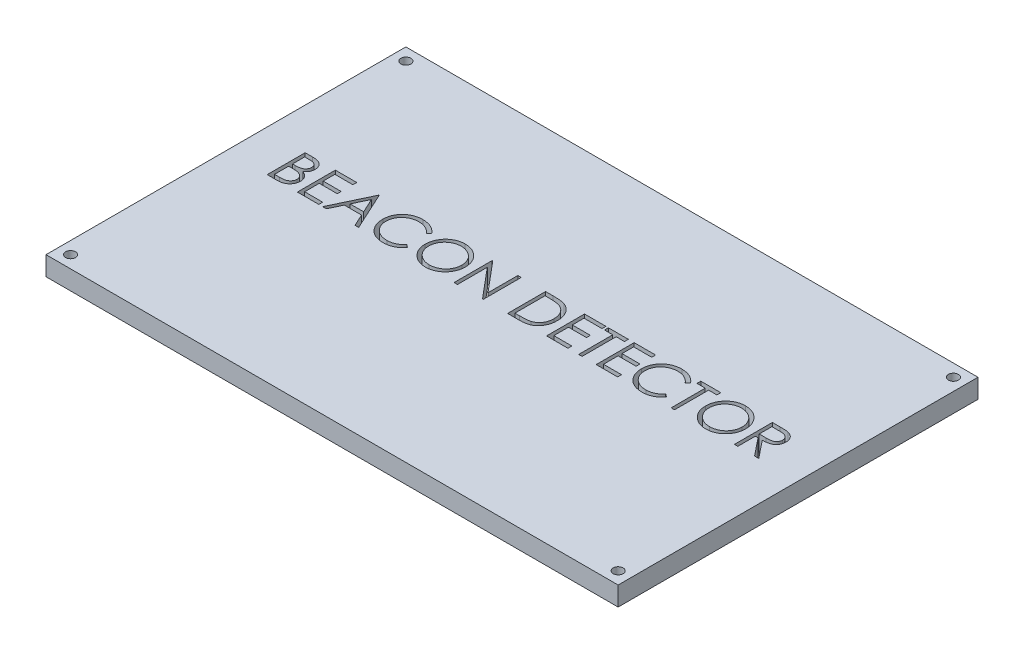
from build123d import *

# Parameters (mm, degrees)
SKETCH1_W           = 159.512
SKETCH1_H           = 100.33
BOSS_EXTRUDE1_DEPTH = 5.334
SKETCH2_R           = 1.397
CUT_EXTRUDE1_DEPTH  = 147.710432419
CUT_EXTRUDE2_DEPTH  = 147.710432419


with BuildPart() as part:
    # Sketch1 → Boss-Extrude1 (new body)
    with BuildSketch(Plane(origin=(0, 0, 0), x_dir=(1, 0, 0), z_dir=(0, 1, 0))):
        with Locations((-54.024132715, 9.8214611)):
            Rectangle(SKETCH1_W, SKETCH1_H)
    extrude(amount=BOSS_EXTRUDE1_DEPTH)

    # Sketch2 → Cut-Extrude1 (cut, through all)
    with BuildSketch(Plane(origin=(0, 5.334, 0), x_dir=(1, 0, 0), z_dir=(0, 1, 0))):
        with Locations((-130.351132715, 56.5574611)):
            Circle(SKETCH2_R)
        with Locations((22.302867285, 56.5574611)):
            Circle(SKETCH2_R)
        with Locations((22.302867285, -36.9145389)):
            Circle(SKETCH2_R)
        with Locations((-130.351132715, -36.9145389)):
            Circle(SKETCH2_R)
    extrude(amount=-CUT_EXTRUDE1_DEPTH, mode=Mode.SUBTRACT)

    # Sketch3 → Cut-Extrude2 (cut, through all)
    # profile 1 of 14: a face of its own
    with BuildSketch(Plane(origin=(0, 5.334, 0), x_dir=(1, 0, 0), z_dir=(0, 1, 0))):
        with BuildLine():
            Line((-122.273064339, 20.404794434), (-120.208127106, 20.404794434))
            add(Edge.make_bspline(
                [(-120.208127106, 20.404794434), (-120.107045755, 20.404262998), (-119.911124941, 20.403232943), (-119.626223295, 20.387257761), (-119.359375701, 20.365475235), (-119.110504771, 20.330912812), (-118.879725504, 20.289209105), (-118.66634241, 20.238705995), (-118.471034032, 20.17814933), (-118.237859805, 20.081852241), (-117.972004474, 19.938755994), (-117.684142667, 19.727305333), (-117.437991753, 19.468671456), (-117.225761698, 19.176926284), (-117.057029742, 18.855991926), (-116.934960676, 18.513517713), (-116.857678529, 18.153921017), (-116.849730644, 17.907047598), (-116.845713912, 17.782281747)],
                knots=[0, 0, 0, 0, 1.001505555, 1.941167018, 2.826882275, 3.653841531, 4.429895133, 5.150066043, 5.825578002, 6.45369114, 7.647487171, 8.808567382, 9.977351308, 11.170798116, 12.373658725, 13.556498008, 14.765093433, 16, 16, 16, 16], degree=3))
            add(Edge.make_bspline(
                [(-116.845713912, 17.782281747), (-116.849019596, 17.665403781), (-116.855515577, 17.435727555), (-116.917632969, 17.09980013), (-117.014880704, 16.780028587), (-117.150060862, 16.477579945), (-117.325750232, 16.19928783), (-117.533964672, 15.942907287), (-117.785173098, 15.719293377), (-117.9733848, 15.594280314), (-118.068987817, 15.530779343)],
                knots=[0, 0, 0, 0, 1.044552857, 2.05264487, 3.044412934, 4.028983338, 5.005914585, 5.980388656, 6.974128949, 8, 8, 8, 8], degree=3))
            add(Edge.make_bspline(
                [(-118.068987817, 15.530779343), (-117.948759857, 15.484620894), (-117.718733987, 15.396308346), (-117.402183426, 15.240172538), (-117.129451395, 15.070349014), (-116.898440977, 14.884893181), (-116.700872354, 14.68499273), (-116.528355126, 14.467716551), (-116.381151923, 14.230230307), (-116.255019988, 13.975010093), (-116.156598749, 13.704661962), (-116.082890657, 13.421721758), (-116.040655752, 13.127204056), (-116.034645503, 12.926769694), (-116.031611348, 12.825584364)],
                knots=[0, 0, 0, 0, 1.27268992, 2.434971085, 3.483601985, 4.442670788, 5.356604649, 6.2567628, 7.179492994, 8.113709626, 9.066344395, 10.018646069, 10.999752585, 12, 12, 12, 12], degree=3))
            add(Edge.make_bspline(
                [(-116.031611348, 12.825584364), (-116.034565144, 12.722270251), (-116.040376821, 12.518996839), (-116.083254355, 12.220380122), (-116.155853321, 11.93500826), (-116.255854168, 11.661035445), (-116.386368786, 11.398991705), (-116.545203345, 11.148580169), (-116.734589264, 10.912316836), (-116.946446034, 10.687576357), (-117.186119664, 10.485501857), (-117.444703019, 10.305537696), (-117.725452605, 10.157534127), (-118.023757444, 10.03320711), (-118.342963828, 9.938237724), (-118.681638379, 9.871796846), (-119.039489006, 9.827029234), (-119.285051825, 9.823348638), (-119.410985012, 9.8214611)],
                knots=[0, 0, 0, 0, 0.978564426, 1.925352924, 2.850884081, 3.763762016, 4.682927383, 5.618979971, 6.567305752, 7.547517671, 8.540179244, 9.531824382, 10.526200242, 11.540722885, 12.589160233, 13.674978461, 14.80764778, 16, 16, 16, 16], degree=3))
            Line((-119.410985012, 9.8214611), (-122.273064339, 9.8214611))
            Line((-122.273064339, 9.8214611), (-122.273064339, 20.404794434))
        make_face()
        with BuildLine():
            Line((-121.323278014, 19.319324348), (-121.323278014, 15.927230331))
            Line((-121.323278014, 15.927230331), (-120.685140327, 15.927230331))
            add(Edge.make_bspline(
                [(-120.685140327, 15.927230331), (-120.591859446, 15.928439622), (-120.411621774, 15.930776219), (-120.150606849, 15.937469473), (-119.908324056, 15.956211175), (-119.685191608, 15.974947492), (-119.481560885, 16.005411126), (-119.297883018, 16.041673021), (-119.131275355, 16.08002371), (-118.939143873, 16.14524573), (-118.721209005, 16.241637748), (-118.488880332, 16.391231157), (-118.284064198, 16.569407178), (-118.111110797, 16.774998895), (-117.969561827, 17.001379981), (-117.871246545, 17.244938405), (-117.804579757, 17.499604043), (-117.798557746, 17.674435426), (-117.795500236, 17.763201218)],
                knots=[0, 0, 0, 0, 1.156816544, 2.235205308, 3.236616184, 4.169592532, 5.011045266, 5.787822928, 6.49130361, 7.128639758, 8.301311294, 9.436451833, 10.541879658, 11.654887649, 12.756523258, 13.837046038, 14.901820046, 16, 16, 16, 16], degree=3))
            add(Edge.make_bspline(
                [(-117.795500236, 17.763201218), (-117.797091305, 17.821941051), (-117.80021236, 17.937165647), (-117.825773537, 18.105136313), (-117.869218345, 18.26311147), (-117.925020613, 18.413256042), (-118.003000696, 18.550875208), (-118.094814025, 18.680727252), (-118.205744565, 18.798390086), (-118.332010724, 18.908364522), (-118.477179655, 19.005865832), (-118.641164752, 19.091260521), (-118.826184633, 19.160024298), (-119.029121123, 19.220246949), (-119.253097983, 19.262544885), (-119.495530561, 19.29778251), (-119.758404592, 19.315721992), (-119.940271926, 19.318096779), (-120.034282288, 19.319324348)],
                knots=[0, 0, 0, 0, 0.91205012, 1.789085906, 2.630437955, 3.453916878, 4.269457761, 5.079663411, 5.91843418, 6.774407191, 7.675494373, 8.627863946, 9.638891023, 10.736472738, 11.911756761, 13.175263542, 14.539845004, 16, 16, 16, 16], degree=3))
            Line((-120.034282288, 19.319324348), (-121.323278014, 19.319324348))
        make_face(mode=Mode.SUBTRACT)
        with BuildLine():
            Line((-121.323278014, 14.841760246), (-121.323278014, 10.906931186))
            Line((-121.323278014, 10.906931186), (-119.970680525, 10.906931186))
            add(Edge.make_bspline(
                [(-119.970680525, 10.906931186), (-119.873861392, 10.908091565), (-119.687255277, 10.910328042), (-119.417830128, 10.917629195), (-119.168114553, 10.934236791), (-118.939248047, 10.960380194), (-118.728759297, 10.988738838), (-118.539173386, 11.026872949), (-118.368953491, 11.070563853), (-118.171576418, 11.138098136), (-117.949315809, 11.243013655), (-117.709797268, 11.401201911), (-117.496841798, 11.589655723), (-117.316002086, 11.807765868), (-117.167796144, 12.044927262), (-117.05998084, 12.296342963), (-116.993484678, 12.557858724), (-116.985434785, 12.736162831), (-116.981397672, 12.825584364)],
                knots=[0, 0, 0, 0, 1.160039823, 2.235823828, 3.228722157, 4.157150951, 4.99529583, 5.772374946, 6.472645482, 7.099169577, 8.269452708, 9.405989375, 10.527446681, 11.663510218, 12.788923519, 13.866172445, 14.929861265, 16, 16, 16, 16], degree=3))
            add(Edge.make_bspline(
                [(-116.981397672, 12.825584364), (-116.982232559, 12.881504703), (-116.983888866, 12.992443382), (-117.008867392, 13.155474549), (-117.045195046, 13.313395642), (-117.092159144, 13.466635477), (-117.160556104, 13.612423543), (-117.240404466, 13.753643187), (-117.334025847, 13.89048109), (-117.479907016, 14.063480046), (-117.692093731, 14.262800538), (-117.993588028, 14.457949652), (-118.336404262, 14.615332307), (-118.585044538, 14.682156914), (-118.71348568, 14.716676779)],
                knots=[0, 0, 0, 0, 0.723448775, 1.435228256, 2.130040452, 2.821711965, 3.505591119, 4.210454504, 4.921174351, 5.648778258, 7.137944449, 8.670945889, 10.280296675, 12, 12, 12, 12], degree=3))
            add(Edge.make_bspline(
                [(-118.71348568, 14.716676779), (-118.764978422, 14.727124294), (-118.876625308, 14.749776664), (-119.058681564, 14.773688052), (-119.266525739, 14.794990972), (-119.500637772, 14.81074852), (-119.761313863, 14.827036402), (-120.049110736, 14.833370742), (-120.362853092, 14.840928028), (-120.580544314, 14.841475744), (-120.693620562, 14.841760246)],
                knots=[0, 0, 0, 0, 0.634451884, 1.375622551, 2.216452059, 3.157844607, 4.20941857, 5.370758133, 6.634282058, 8, 8, 8, 8], degree=3))
            Line((-120.693620562, 14.841760246), (-121.323278014, 14.841760246))
        make_face(mode=Mode.SUBTRACT)
    # profile 2 of 14: a face of its own
    with BuildSketch(Plane(origin=(0, 5.334, 0), x_dir=(1, 0, 0), z_dir=(0, 1, 0))):
        Polygon((-113.860671177, 20.404794434), (-107.890585707, 20.404794434), (-107.890585707, 19.319324348), (-112.910884852, 19.319324348), (-112.910884852, 16.062914092), (-107.890585707, 16.062914092), (-107.890585707, 14.977444006), (-112.910884852, 14.977444006), (-112.910884852, 10.906931186), (-107.890585707, 10.906931186), (-107.890585707, 9.8214611), (-113.860671177, 9.8214611), align=None)
    # profile 3 of 14: a face of its own
    with BuildSketch(Plane(origin=(0, 5.334, 0), x_dir=(1, 0, 0), z_dir=(0, 1, 0))):
        Polygon((-101.649132715, 20.404794434), (-96.76451733, 9.8214611), (-97.796985947, 9.8214611), (-99.361589312, 13.213555117), (-104.159282288, 13.213555117), (-105.768406887, 9.8214611), (-106.805115621, 9.8214611), (-101.784816476, 20.404794434), align=None)
        Polygon((-101.727574889, 18.341977259), (-103.644108009, 14.299025203), (-99.86192318, 14.299025203), align=None, mode=Mode.SUBTRACT)
    # profile 4 of 14: a face of its own
    with BuildSketch(Plane(origin=(0, 5.334, 0), x_dir=(1, 0, 0), z_dir=(0, 1, 0))):
        with BuildLine():
            Line((-85.095713912, 18.462820609), (-85.926776946, 17.826802981))
            add(Edge.make_bspline(
                [(-85.926776946, 17.826802981), (-85.986061418, 17.897457223), (-86.103831078, 18.037813135), (-86.293300572, 18.234903662), (-86.490760301, 18.419553381), (-86.696134787, 18.592641922), (-86.913120696, 18.748116428), (-87.136461682, 18.894079048), (-87.369893867, 19.024912447), (-87.692690779, 19.183550524), (-88.114959272, 19.349092469), (-88.646529381, 19.487895097), (-89.201431988, 19.576254366), (-89.580005682, 19.585824244), (-89.772563538, 19.59069187)],
                knots=[0, 0, 0, 0, 0.757959112, 1.505699292, 2.245454638, 2.979532153, 3.711538275, 4.438200793, 5.171680507, 5.909471876, 7.393775596, 8.890124382, 10.418191784, 12, 12, 12, 12], degree=3))
            add(Edge.make_bspline(
                [(-89.772563538, 19.59069187), (-89.878648752, 19.589470364), (-90.089834611, 19.587038689), (-90.403247852, 19.554958715), (-90.710808745, 19.509870056), (-91.012317226, 19.442967293), (-91.307389505, 19.358383421), (-91.597954626, 19.257311336), (-91.879805725, 19.132262178), (-92.156841827, 18.994049106), (-92.422269441, 18.837937547), (-92.673412085, 18.667656697), (-92.909353798, 18.485112048), (-93.13028122, 18.289619417), (-93.336420207, 18.082059203), (-93.526277075, 17.860219409), (-93.699194863, 17.624809265), (-93.858601106, 17.378933009), (-94.001363419, 17.123306829), (-94.120894244, 16.856984592), (-94.226743066, 16.584526948), (-94.3105003, 16.30285558), (-94.376795863, 16.013952455), (-94.422539035, 15.717042215), (-94.454254174, 15.412745136), (-94.456673757, 15.206493167), (-94.457893399, 15.102527473)],
                knots=[0, 0, 0, 0, 1.054917814, 2.100044995, 3.131103042, 4.146048494, 5.169673617, 6.183595914, 7.203665975, 8.234915748, 9.262203917, 10.264457458, 11.251630812, 12.227803204, 13.197192746, 14.159520551, 15.12972552, 16.100847026, 17.073214652, 18.039054194, 19.002613845, 19.979014051, 20.95965708, 21.949030935, 22.966165397, 24, 24, 24, 24], degree=3))
            add(Edge.make_bspline(
                [(-94.457893399, 15.102527473), (-94.454077898, 14.946101815), (-94.44658667, 14.638980785), (-94.379916707, 14.189126796), (-94.278603693, 13.758171425), (-94.126761353, 13.348808569), (-93.939529938, 12.955990438), (-93.702945232, 12.586363429), (-93.428938083, 12.234341913), (-93.113632101, 11.90824538), (-92.767690705, 11.610358639), (-92.396524401, 11.348041405), (-92.001057626, 11.129374975), (-91.585656863, 10.947414374), (-91.147125518, 10.807542841), (-90.686252187, 10.709075134), (-90.204039249, 10.644842826), (-89.87453654, 10.638693341), (-89.706841716, 10.635563664)],
                knots=[0, 0, 0, 0, 1.029171465, 2.020641659, 2.987623507, 3.938342917, 4.889210282, 5.84687017, 6.821220943, 7.821438502, 8.827599549, 9.822697543, 10.807740252, 11.797342354, 12.80366471, 13.83203677, 14.896651826, 16, 16, 16, 16], degree=3))
            add(Edge.make_bspline(
                [(-89.706841716, 10.635563664), (-89.522078823, 10.640670213), (-89.158421251, 10.650721121), (-88.625117933, 10.735869327), (-88.114590737, 10.873930174), (-87.626812202, 11.06714532), (-87.163157438, 11.318318929), (-86.72290087, 11.622810129), (-86.305670883, 11.983515326), (-86.05478153, 12.258933357), (-85.926776946, 12.399452553)],
                knots=[0, 0, 0, 0, 1.028121516, 2.023589091, 2.998037872, 3.967518031, 4.937445131, 5.927275754, 6.942489185, 8, 8, 8, 8], degree=3))
            Line((-85.926776946, 12.399452553), (-85.095713912, 11.769795101))
            add(Edge.make_bspline(
                [(-85.095713912, 11.769795101), (-85.162594863, 11.683500259), (-85.29603641, 11.511323921), (-85.512111842, 11.26859756), (-85.739736051, 11.040287739), (-85.980599745, 10.82823517), (-86.231932115, 10.628196667), (-86.498246012, 10.445855415), (-86.776040467, 10.278666312), (-87.064374249, 10.125580136), (-87.362941007, 9.989758937), (-87.671382988, 9.873482067), (-87.988370681, 9.773318711), (-88.313918575, 9.690914045), (-88.648701935, 9.626594339), (-88.991512655, 9.583596751), (-89.343090611, 9.554139057), (-89.580282527, 9.551454169), (-89.70048154, 9.550093579)],
                knots=[0, 0, 0, 0, 0.986787822, 1.968848986, 2.935600012, 3.899624008, 4.868462664, 5.837806735, 6.815139263, 7.798259679, 8.787526145, 9.778297419, 10.776456485, 11.791383307, 12.812564526, 13.85620153, 14.913611965, 16, 16, 16, 16], degree=3))
            add(Edge.make_bspline(
                [(-89.70048154, 9.550093579), (-89.814308819, 9.550885795), (-90.039388167, 9.552452303), (-90.371701059, 9.577828618), (-90.695217173, 9.612450442), (-91.009011875, 9.664581314), (-91.314797561, 9.726098724), (-91.609802186, 9.808561809), (-91.896928655, 9.90093667), (-92.1750234, 10.009506511), (-92.444322968, 10.13201973), (-92.703958779, 10.270484682), (-92.953811419, 10.423736987), (-93.196337335, 10.588398566), (-93.427953838, 10.769758502), (-93.650668069, 10.965298088), (-93.86572889, 11.174358263), (-93.998784628, 11.325109843), (-94.065682528, 11.400904877)],
                knots=[0, 0, 0, 0, 1.114604814, 2.203992996, 3.262667896, 4.300477797, 5.318619304, 6.316056647, 7.298880507, 8.271930387, 9.238335007, 10.195173496, 11.151986948, 12.108099108, 13.064862484, 14.031167946, 15.010108607, 16, 16, 16, 16], degree=3))
            add(Edge.make_bspline(
                [(-94.065682528, 11.400904877), (-94.172833164, 11.532565139), (-94.385840821, 11.794296144), (-94.658363721, 12.21849423), (-94.891643233, 12.661386195), (-95.080256136, 13.125298837), (-95.227705353, 13.609191175), (-95.329853253, 14.113307135), (-95.396230723, 14.637175912), (-95.403821358, 14.993491916), (-95.407679724, 15.174609471)],
                knots=[0, 0, 0, 0, 0.994628077, 1.977248131, 2.950237994, 3.925870899, 4.908910175, 5.911660606, 6.938484602, 8, 8, 8, 8], degree=3))
            add(Edge.make_bspline(
                [(-95.407679724, 15.174609471), (-95.402977115, 15.364974771), (-95.393725025, 15.739506614), (-95.315118691, 16.289156425), (-95.188666617, 16.815757084), (-95.009061739, 17.31832555), (-94.781352701, 17.799505207), (-94.50005794, 18.255620278), (-94.168445391, 18.689587744), (-93.789115841, 19.094822825), (-93.373138422, 19.465358487), (-92.92767439, 19.791343912), (-92.453595645, 20.062632592), (-91.956124999, 20.289406702), (-91.431537342, 20.463712579), (-90.880951917, 20.585732929), (-90.305403293, 20.661682304), (-89.912724054, 20.671283528), (-89.713201892, 20.676161955)],
                knots=[0, 0, 0, 0, 1.032925535, 2.032216505, 3.007276963, 3.968222605, 4.92396291, 5.891752235, 6.871517503, 7.883894988, 8.900124299, 9.891468569, 10.874487609, 11.85992873, 12.854644235, 13.869047385, 14.917252991, 16, 16, 16, 16], degree=3))
            add(Edge.make_bspline(
                [(-89.713201892, 20.676161955), (-89.591600989, 20.674704061), (-89.350904247, 20.671818306), (-88.994842656, 20.643678305), (-88.648186095, 20.596768115), (-88.310695745, 20.532917142), (-87.980729739, 20.453671194), (-87.660809963, 20.350437435), (-87.349059172, 20.232398399), (-87.047443521, 20.096452562), (-86.757410143, 19.943850749), (-86.47904937, 19.776284458), (-86.214572298, 19.593961427), (-85.962117923, 19.398432302), (-85.72590938, 19.185560468), (-85.499240147, 18.96120107), (-85.289807839, 18.71889165), (-85.160530321, 18.548333873), (-85.095713912, 18.462820609)],
                knots=[0, 0, 0, 0, 1.096760587, 2.17092713, 3.219439832, 4.250915756, 5.268269357, 6.278326846, 7.281116186, 8.274029601, 9.260640565, 10.235837813, 11.203064059, 12.156899882, 13.114053108, 14.069676657, 15.032185724, 16, 16, 16, 16], degree=3))
        make_face()
    # profile 5 of 14: a face of its own
    with BuildSketch(Plane(origin=(0, 5.334, 0), x_dir=(1, 0, 0), z_dir=(0, 1, 0))):
        with BuildLine():
            add(Edge.make_bspline(
                [(-77.972316476, 20.676161955), (-77.776349108, 20.671198434), (-77.391453029, 20.661449669), (-76.825774172, 20.586824761), (-76.285736622, 20.457722034), (-75.766941202, 20.285779206), (-75.275593392, 20.056409993), (-74.807994836, 19.779171569), (-74.365258099, 19.451159419), (-73.953350588, 19.074909138), (-73.576411714, 18.665535361), (-73.244319153, 18.228661681), (-72.966000789, 17.766929588), (-72.737443766, 17.2817266), (-72.558136065, 16.77415003), (-72.434404671, 16.241493879), (-72.355367884, 15.687209364), (-72.346127795, 15.309151939), (-72.341440407, 15.117367884)],
                knots=[0, 0, 0, 0, 1.065120563, 2.091984664, 3.0946048, 4.079830382, 5.057816894, 6.036188127, 7.030412546, 8.04752943, 9.064399622, 10.05169764, 11.02544977, 11.989514704, 12.962713494, 13.945757189, 14.957906945, 16, 16, 16, 16], degree=3))
            add(Edge.make_bspline(
                [(-72.341440407, 15.117367884), (-72.346127108, 14.926996559), (-72.355365138, 14.551752621), (-72.434494537, 14.000985539), (-72.558594704, 13.471544624), (-72.735778651, 12.964313721), (-72.963246169, 12.478757755), (-73.243417758, 12.016154347), (-73.573439991, 11.57635184), (-73.94901785, 11.164168304), (-74.35844481, 10.786199762), (-74.797593474, 10.456849828), (-75.256587561, 10.173445928), (-75.741333583, 9.947314342), (-76.245402742, 9.76657544), (-76.773306433, 9.643347249), (-77.322571013, 9.563860237), (-77.697133334, 9.55473282), (-77.887514125, 9.550093579)],
                knots=[0, 0, 0, 0, 1.043624062, 2.057103931, 3.04512605, 4.022047818, 4.998200453, 5.980619268, 6.982898556, 8.009068085, 9.034988726, 10.034168286, 11.015286542, 11.987931943, 12.962482838, 13.94673481, 14.956375938, 16, 16, 16, 16], degree=3))
            add(Edge.make_bspline(
                [(-77.887514125, 9.550093579), (-78.079297185, 9.55477863), (-78.457352648, 9.564014112), (-79.012333683, 9.643181693), (-79.545364004, 9.766980397), (-80.054919304, 9.943901788), (-80.541283734, 10.17255389), (-81.005408508, 10.45136237), (-81.445430691, 10.782188725), (-81.857702163, 11.157644796), (-82.234919976, 11.566377822), (-82.563787612, 12.004329022), (-82.842658788, 12.462906236), (-83.070543151, 12.943382083), (-83.250957111, 13.443433826), (-83.374040728, 13.96639708), (-83.453675631, 14.509290347), (-83.462852428, 14.878929588), (-83.467508783, 15.066486474)],
                knots=[0, 0, 0, 0, 1.053102029, 2.075944431, 3.073151272, 4.055350789, 5.033113405, 6.020478099, 7.024410459, 8.052272461, 9.079885166, 10.07527673, 11.055994387, 12.023226415, 12.992069828, 13.970394897, 14.97016774, 16, 16, 16, 16], degree=3))
            add(Edge.make_bspline(
                [(-83.467508783, 15.066486474), (-83.465892148, 15.192375736), (-83.46267927, 15.442566109), (-83.423999629, 15.814091305), (-83.36787258, 16.179641627), (-83.287433463, 16.538177589), (-83.182230089, 16.888821519), (-83.058096578, 17.233991683), (-82.906483236, 17.570190085), (-82.735091753, 17.899009389), (-82.543800095, 18.215323771), (-82.332509138, 18.514316796), (-82.108640286, 18.798497429), (-81.863217644, 19.060501465), (-81.604329821, 19.307950854), (-81.327777106, 19.537042879), (-81.035246986, 19.749843326), (-80.725480743, 19.941614358), (-80.406111197, 20.115057455), (-80.07688856, 20.263894957), (-79.742284165, 20.391639), (-79.400730825, 20.495176733), (-79.053135538, 20.576916461), (-78.698739665, 20.632576793), (-78.337825543, 20.671355087), (-78.094677031, 20.674552772), (-77.972316476, 20.676161955)],
                knots=[0, 0, 0, 0, 1.037015668, 2.060948919, 3.074880161, 4.083647147, 5.086022904, 6.090072063, 7.104153813, 8.122640571, 9.144368836, 10.147691507, 11.138137339, 12.123020368, 13.103399296, 14.087645067, 15.080126199, 16.082011238, 17.087798457, 18.072939717, 19.057185487, 20.037253025, 21.01195951, 21.997135196, 22.992090687, 24, 24, 24, 24], degree=3))
        make_face()
        with BuildLine():
            add(Edge.make_bspline(
                [(-77.925675183, 19.59069187), (-78.026109908, 19.589467559), (-78.226019196, 19.587030641), (-78.523212913, 19.554930739), (-78.816498046, 19.509180837), (-79.105935165, 19.443922429), (-79.39031323, 19.355010174), (-79.672282988, 19.252681713), (-79.949273175, 19.128036987), (-80.220369364, 18.98721), (-80.483183996, 18.831335882), (-80.731174784, 18.659064111), (-80.964983731, 18.474434673), (-81.184038371, 18.277016688), (-81.387695487, 18.065804797), (-81.579963512, 17.844001002), (-81.753135819, 17.605265522), (-81.911842206, 17.356072149), (-82.053864009, 17.096745463), (-82.180154486, 16.830015642), (-82.283459941, 16.553706922), (-82.36771046, 16.270816969), (-82.437559888, 15.981793817), (-82.481810087, 15.684444941), (-82.514262698, 15.380264483), (-82.516560326, 15.174700306), (-82.517722459, 15.070726592)],
                knots=[0, 0, 0, 0, 1.008559885, 2.007477868, 2.99961109, 3.989939068, 4.984837346, 5.991145699, 7.001802488, 8.033829008, 9.059044045, 10.069351652, 11.065060232, 12.050310815, 13.029377138, 14.011219647, 14.996725999, 15.989392538, 16.977580475, 17.965360261, 18.951710183, 19.937753436, 20.929683414, 21.935841486, 22.955955122, 24, 24, 24, 24], degree=3))
            add(Edge.make_bspline(
                [(-82.517722459, 15.070726592), (-82.513867519, 14.917836067), (-82.50628366, 14.617053106), (-82.43988815, 14.176278005), (-82.337616942, 13.75267771), (-82.186857762, 13.348570032), (-81.99832138, 12.960481367), (-81.765406736, 12.591854479), (-81.489456643, 12.24258974), (-81.175997884, 11.915125475), (-80.833331605, 11.61623459), (-80.46946835, 11.353878569), (-80.088306251, 11.131899956), (-79.688851329, 10.951060809), (-79.273236151, 10.807763268), (-78.838782604, 10.709554074), (-78.388384786, 10.644918769), (-78.081375424, 10.638711626), (-77.925675183, 10.635563664)],
                knots=[0, 0, 0, 0, 1.032063989, 2.030389145, 3.003944642, 3.970395727, 4.937377036, 5.913328081, 6.909231446, 7.93887556, 8.970685674, 9.976071282, 10.964166581, 11.944589148, 12.933237628, 13.927779006, 14.949070134, 16, 16, 16, 16], degree=3))
            add(Edge.make_bspline(
                [(-77.925675183, 10.635563664), (-77.821022642, 10.637001499), (-77.613465223, 10.639853157), (-77.30474781, 10.668575346), (-77.001592122, 10.714633618), (-76.704423371, 10.780947744), (-76.413578822, 10.863942868), (-76.127844537, 10.962542426), (-75.850263992, 11.085554637), (-75.577335435, 11.221468681), (-75.316089657, 11.376409158), (-75.066699357, 11.542834039), (-74.83545056, 11.727191535), (-74.616559797, 11.921676349), (-74.412066547, 12.130209889), (-74.223353666, 12.352521036), (-74.0510566, 12.590013023), (-73.892410478, 12.838828417), (-73.750886326, 13.098864705), (-73.627578098, 13.366561588), (-73.522966034, 13.641259895), (-73.438515555, 13.923355837), (-73.372338087, 14.212313642), (-73.326739282, 14.508520211), (-73.294842812, 14.811382985), (-73.292438651, 15.016227502), (-73.291226732, 15.119487943)],
                knots=[0, 0, 0, 0, 1.047197238, 2.076906641, 3.100256066, 4.114471768, 5.12198147, 6.126382909, 7.136867548, 8.15857795, 9.17633901, 10.174870724, 11.156907918, 12.133735059, 13.104061851, 14.077631395, 15.04955518, 16.038496417, 17.029181396, 18.010275684, 18.986308667, 19.968651475, 20.955262928, 21.950658345, 22.966943676, 24, 24, 24, 24], degree=3))
            add(Edge.make_bspline(
                [(-73.291226732, 15.119487943), (-73.292439621, 15.222041968), (-73.294845611, 15.425476767), (-73.326724046, 15.726227337), (-73.372386262, 16.020302524), (-73.438192546, 16.306547833), (-73.523010868, 16.585036231), (-73.627596367, 16.855506158), (-73.750923344, 17.118965224), (-73.892462498, 17.374762265), (-74.051562727, 17.620219211), (-74.225414367, 17.854874125), (-74.41701911, 18.074320271), (-74.620902566, 18.28397518), (-74.842157386, 18.47936737), (-75.079781323, 18.660561658), (-75.330889587, 18.831930845), (-75.596764799, 18.986524806), (-75.87115723, 19.129291652), (-76.152716103, 19.251607781), (-76.438251714, 19.355542523), (-76.727037958, 19.444191441), (-77.021505536, 19.508925246), (-77.319664733, 19.554971968), (-77.621103038, 19.587019469), (-77.823828965, 19.589463851), (-77.925675183, 19.59069187)],
                knots=[0, 0, 0, 0, 1.02996197, 2.043119294, 3.035359645, 4.018872909, 4.991431989, 5.957985074, 6.929999688, 7.912076566, 8.892894881, 9.867085534, 10.843653904, 11.817741046, 12.803660682, 13.806313499, 14.818574707, 15.856120519, 16.894564902, 17.924820532, 18.937903209, 19.946497019, 20.957711757, 21.963978472, 22.977135795, 24, 24, 24, 24], degree=3))
        make_face(mode=Mode.SUBTRACT)
    # profile 6 of 14: a face of its own
    with BuildSketch(Plane(origin=(0, 5.334, 0), x_dir=(1, 0, 0), z_dir=(0, 1, 0))):
        Polygon((-70.170500236, 9.8214611), (-70.170500236, 20.404794434), (-69.971214713, 20.404794434), (-62.97926092, 12.075083563), (-62.97926092, 20.404794434), (-62.029474595, 20.404794434), (-62.029474595, 9.8214611), (-62.245720589, 9.8214611), (-69.220713912, 18.132091442), (-69.220713912, 9.8214611), align=None)
    # profile 7 of 14: a face of its own
    with BuildSketch(Plane(origin=(0, 5.334, 0), x_dir=(1, 0, 0), z_dir=(0, 1, 0))):
        with BuildLine():
            Line((-55.245286561, 9.8214611), (-55.245286561, 20.404794434))
            Line((-55.245286561, 20.404794434), (-53.10826733, 20.404794434))
            add(Edge.make_bspline(
                [(-53.10826733, 20.404794434), (-52.922396819, 20.403456186), (-52.563295957, 20.400870699), (-52.044372604, 20.384477445), (-51.564240751, 20.355477703), (-51.124479486, 20.313236517), (-50.723881536, 20.261369011), (-50.363568602, 20.196355883), (-50.041677598, 20.119586892), (-49.84371048, 20.054135173), (-49.750094254, 20.023183857)],
                knots=[0, 0, 0, 0, 1.314313732, 2.53924729, 3.670748893, 4.714932338, 5.66265055, 6.526160246, 7.303039223, 8, 8, 8, 8], degree=3))
            add(Edge.make_bspline(
                [(-49.750094254, 20.023183857), (-49.627645875, 19.976524342), (-49.385525841, 19.884263396), (-49.040790018, 19.710224104), (-48.716258564, 19.513032105), (-48.410191149, 19.292427473), (-48.129579127, 19.042163848), (-47.86346001, 18.772872184), (-47.62272025, 18.474759822), (-47.40225945, 18.154009263), (-47.203487337, 17.81439901), (-47.030709408, 17.456576181), (-46.887217571, 17.082357957), (-46.768099957, 16.692785009), (-46.674221383, 16.287000724), (-46.610171256, 15.864532605), (-46.567925644, 15.427050295), (-46.56368006, 15.130189416), (-46.561525877, 14.979564065)],
                knots=[0, 0, 0, 0, 0.984719456, 1.947108742, 2.898477687, 3.838006223, 4.779231079, 5.722358779, 6.681677486, 7.655904652, 8.64651281, 9.637519902, 10.640069247, 11.656948941, 12.698408672, 13.768548281, 14.867775369, 16, 16, 16, 16], degree=3))
            add(Edge.make_bspline(
                [(-46.561525877, 14.979564065), (-46.563427755, 14.84875032), (-46.567175604, 14.590968173), (-46.600828536, 14.211054036), (-46.649742646, 13.842410618), (-46.72547153, 13.486793382), (-46.81740294, 13.141086628), (-46.935223112, 12.808974841), (-47.07019235, 12.487411418), (-47.227581269, 12.180744288), (-47.400365933, 11.890206472), (-47.585791204, 11.616323327), (-47.783659307, 11.363003014), (-47.995857054, 11.129478401), (-48.219642292, 10.916101533), (-48.456480148, 10.721089963), (-48.706981754, 10.548259428), (-48.97002513, 10.39081841), (-49.253283902, 10.253475907), (-49.562123307, 10.137270877), (-49.89786044, 10.040972778), (-50.259671215, 9.960627451), (-50.648180778, 9.896893702), (-51.063770032, 9.854178182), (-51.505800456, 9.825291933), (-51.809328234, 9.822762839), (-51.965555658, 9.8214611)],
                knots=[0, 0, 0, 0, 1.105936401, 2.179363191, 3.223086493, 4.248585256, 5.251745608, 6.245858792, 7.225916811, 8.198733463, 9.158002045, 10.082870192, 10.993790845, 11.873723703, 12.748670949, 13.606408763, 14.465103618, 15.319838547, 16.196477973, 17.123216899, 18.106603292, 19.147568657, 20.255746949, 21.433717677, 22.679120308, 24, 24, 24, 24], degree=3))
            Line((-51.965555658, 9.8214611), (-55.245286561, 9.8214611))
        make_face()
        with BuildLine():
            Line((-54.295500236, 10.906931186), (-53.080706567, 10.906931186))
            add(Edge.make_bspline(
                [(-53.080706567, 10.906931186), (-52.906146969, 10.907681382), (-52.570404936, 10.909124284), (-52.087629563, 10.921785589), (-51.646518055, 10.942474304), (-51.247007777, 10.971427516), (-50.889324298, 11.009734995), (-50.572720102, 11.052446011), (-50.298233012, 11.10565735), (-50.132136857, 11.153890013), (-50.055382715, 11.176178648)],
                knots=[0, 0, 0, 0, 1.375205317, 2.645023457, 3.804390687, 4.853969522, 5.800190428, 6.637939096, 7.370582563, 8, 8, 8, 8], degree=3))
            add(Edge.make_bspline(
                [(-50.055382715, 11.176178648), (-49.958776954, 11.210201217), (-49.767872857, 11.277433727), (-49.493065766, 11.400072369), (-49.236776728, 11.545342437), (-48.994539271, 11.706820742), (-48.769789622, 11.8902027), (-48.559864318, 12.09150069), (-48.365186014, 12.311739177), (-48.187766083, 12.550644808), (-48.028990973, 12.806730619), (-47.891494636, 13.077478997), (-47.770991196, 13.359923399), (-47.676410689, 13.658401093), (-47.602280233, 13.970243722), (-47.549772724, 14.295473224), (-47.517071057, 14.634028862), (-47.513256679, 14.864298381), (-47.511312202, 14.981684124)],
                knots=[0, 0, 0, 0, 0.998632004, 1.973411704, 2.929992603, 3.868527914, 4.809262121, 5.754881198, 6.702106254, 7.672490631, 8.653608572, 9.636854334, 10.631411391, 11.644891563, 12.686317036, 13.754757253, 14.855430412, 16, 16, 16, 16], degree=3))
            add(Edge.make_bspline(
                [(-47.511312202, 14.981684124), (-47.512864285, 15.105459171), (-47.515913367, 15.348616348), (-47.554238067, 15.705397736), (-47.610243723, 16.048541608), (-47.691232488, 16.378070913), (-47.794437765, 16.694628549), (-47.923235848, 16.996463735), (-48.070394435, 17.286764172), (-48.245483096, 17.558829516), (-48.437239771, 17.81613487), (-48.650049073, 18.051855686), (-48.880529999, 18.266528927), (-49.126168711, 18.463497801), (-49.393888035, 18.634837964), (-49.677381338, 18.788104833), (-49.980807534, 18.918176695), (-50.191907828, 18.987358018), (-50.299189473, 19.022516122)],
                knots=[0, 0, 0, 0, 1.122418816, 2.205001699, 3.251619955, 4.274784885, 5.280384055, 6.268708349, 7.249350384, 8.229342522, 9.199999885, 10.157847722, 11.105861043, 12.055065948, 13.010012805, 13.98527497, 14.976112212, 16, 16, 16, 16], degree=3))
            add(Edge.make_bspline(
                [(-50.299189473, 19.022516122), (-50.387941748, 19.047058654), (-50.576653438, 19.09924281), (-50.884596579, 19.156167151), (-51.23117096, 19.206375993), (-51.617915294, 19.248884826), (-52.04438873, 19.279386965), (-52.510919263, 19.302281178), (-53.017708543, 19.317722662), (-53.369022396, 19.318777086), (-53.551359611, 19.319324348)],
                knots=[0, 0, 0, 0, 0.674548936, 1.434276114, 2.292660221, 3.240891867, 4.284742987, 5.42552168, 6.663806718, 8, 8, 8, 8], degree=3))
            Line((-53.551359611, 19.319324348), (-54.295500236, 19.319324348))
            Line((-54.295500236, 19.319324348), (-54.295500236, 10.906931186))
        make_face(mode=Mode.SUBTRACT)
    # profile 8 of 14: a face of its own
    with BuildSketch(Plane(origin=(0, 5.334, 0), x_dir=(1, 0, 0), z_dir=(0, 1, 0))):
        Polygon((-44.390585707, 20.404794434), (-38.420500236, 20.404794434), (-38.420500236, 19.319324348), (-43.440799382, 19.319324348), (-43.440799382, 16.062914092), (-38.420500236, 16.062914092), (-38.420500236, 14.977444006), (-43.440799382, 14.977444006), (-43.440799382, 10.906931186), (-38.420500236, 10.906931186), (-38.420500236, 9.8214611), (-44.390585707, 9.8214611), align=None)
    # profile 9 of 14: a face of its own
    with BuildSketch(Plane(origin=(0, 5.334, 0), x_dir=(1, 0, 0), z_dir=(0, 1, 0))):
        Polygon((-37.742081433, 19.319324348), (-37.742081433, 20.404794434), (-32.179047245, 20.404794434), (-32.179047245, 19.319324348), (-34.485671177, 19.319324348), (-34.485671177, 9.8214611), (-35.435457501, 9.8214611), (-35.435457501, 19.319324348), align=None)
    # profile 10 of 14: a face of its own
    with BuildSketch(Plane(origin=(0, 5.334, 0), x_dir=(1, 0, 0), z_dir=(0, 1, 0))):
        Polygon((-30.550842117, 20.404794434), (-24.580756647, 20.404794434), (-24.580756647, 19.319324348), (-29.601055792, 19.319324348), (-29.601055792, 16.062914092), (-24.580756647, 16.062914092), (-24.580756647, 14.977444006), (-29.601055792, 14.977444006), (-29.601055792, 10.906931186), (-24.580756647, 10.906931186), (-24.580756647, 9.8214611), (-30.550842117, 9.8214611), align=None)
    # profile 11 of 14: a face of its own
    with BuildSketch(Plane(origin=(0, 5.334, 0), x_dir=(1, 0, 0), z_dir=(0, 1, 0))):
        with BuildLine():
            Line((-12.911953228, 18.462820609), (-13.743016262, 17.826802981))
            add(Edge.make_bspline(
                [(-13.743016262, 17.826802981), (-13.802300734, 17.897457223), (-13.920070395, 18.037813135), (-14.109539888, 18.234903662), (-14.306999618, 18.419553381), (-14.512374103, 18.592641922), (-14.729360012, 18.748116428), (-14.952700999, 18.894079048), (-15.186133183, 19.024912447), (-15.508930095, 19.183550524), (-15.931198588, 19.349092469), (-16.462768697, 19.487895097), (-17.017671304, 19.576254366), (-17.396244999, 19.585824244), (-17.588802854, 19.59069187)],
                knots=[0, 0, 0, 0, 0.757959112, 1.505699292, 2.245454638, 2.979532153, 3.711538275, 4.438200793, 5.171680507, 5.909471876, 7.393775596, 8.890124382, 10.418191784, 12, 12, 12, 12], degree=3))
            add(Edge.make_bspline(
                [(-17.588802854, 19.59069187), (-17.694888069, 19.589470364), (-17.906073927, 19.587038689), (-18.219487168, 19.554958715), (-18.527048061, 19.509870056), (-18.828556542, 19.442967293), (-19.123628822, 19.358383421), (-19.414193942, 19.257311336), (-19.696045042, 19.132262178), (-19.973081143, 18.994049106), (-20.238508757, 18.837937547), (-20.489651402, 18.667656697), (-20.725593114, 18.485112048), (-20.946520536, 18.289619417), (-21.152659523, 18.082059203), (-21.342516392, 17.860219409), (-21.51543418, 17.624809265), (-21.674840422, 17.378933009), (-21.817602735, 17.123306829), (-21.937133561, 16.856984592), (-22.042982383, 16.584526948), (-22.126739616, 16.30285558), (-22.193035179, 16.013952455), (-22.238778351, 15.717042215), (-22.27049349, 15.412745136), (-22.272913073, 15.206493167), (-22.274132715, 15.102527473)],
                knots=[0, 0, 0, 0, 1.054917814, 2.100044995, 3.131103042, 4.146048494, 5.169673617, 6.183595914, 7.203665975, 8.234915748, 9.262203917, 10.264457458, 11.251630812, 12.227803204, 13.197192746, 14.159520551, 15.12972552, 16.100847026, 17.073214652, 18.039054194, 19.002613845, 19.979014051, 20.95965708, 21.949030935, 22.966165397, 24, 24, 24, 24], degree=3))
            add(Edge.make_bspline(
                [(-22.274132715, 15.102527473), (-22.270317215, 14.946101815), (-22.262825986, 14.638980785), (-22.196156023, 14.189126796), (-22.094843009, 13.758171425), (-21.943000669, 13.348808569), (-21.755769255, 12.955990438), (-21.519184548, 12.586363429), (-21.2451774, 12.234341913), (-20.929871417, 11.90824538), (-20.583930021, 11.610358639), (-20.212763717, 11.348041405), (-19.817296942, 11.129374975), (-19.401896179, 10.947414374), (-18.963364835, 10.807542841), (-18.502491504, 10.709075134), (-18.020278566, 10.644842826), (-17.690775856, 10.638693341), (-17.523081032, 10.635563664)],
                knots=[0, 0, 0, 0, 1.029171465, 2.020641659, 2.987623507, 3.938342917, 4.889210282, 5.84687017, 6.821220943, 7.821438502, 8.827599549, 9.822697543, 10.807740252, 11.797342354, 12.80366471, 13.83203677, 14.896651826, 16, 16, 16, 16], degree=3))
            add(Edge.make_bspline(
                [(-17.523081032, 10.635563664), (-17.338318139, 10.640670213), (-16.974660567, 10.650721121), (-16.44135725, 10.735869327), (-15.930830053, 10.873930174), (-15.443051518, 11.06714532), (-14.979396754, 11.318318929), (-14.539140186, 11.622810129), (-14.121910199, 11.983515326), (-13.871020846, 12.258933357), (-13.743016262, 12.399452553)],
                knots=[0, 0, 0, 0, 1.028121516, 2.023589091, 2.998037872, 3.967518031, 4.937445131, 5.927275754, 6.942489185, 8, 8, 8, 8], degree=3))
            Line((-13.743016262, 12.399452553), (-12.911953228, 11.769795101))
            add(Edge.make_bspline(
                [(-12.911953228, 11.769795101), (-12.978834179, 11.683500259), (-13.112275726, 11.511323921), (-13.328351158, 11.26859756), (-13.555975367, 11.040287739), (-13.796839061, 10.82823517), (-14.048171431, 10.628196667), (-14.314485328, 10.445855415), (-14.592279784, 10.278666312), (-14.880613565, 10.125580136), (-15.179180323, 9.989758937), (-15.487622305, 9.873482067), (-15.804609997, 9.773318711), (-16.130157892, 9.690914045), (-16.464941252, 9.626594339), (-16.807751971, 9.583596751), (-17.159329927, 9.554139057), (-17.396521843, 9.551454169), (-17.516720856, 9.550093579)],
                knots=[0, 0, 0, 0, 0.986787822, 1.968848986, 2.935600012, 3.899624008, 4.868462664, 5.837806735, 6.815139263, 7.798259679, 8.787526145, 9.778297419, 10.776456485, 11.791383307, 12.812564526, 13.85620153, 14.913611965, 16, 16, 16, 16], degree=3))
            add(Edge.make_bspline(
                [(-17.516720856, 9.550093579), (-17.630548135, 9.550885795), (-17.855627484, 9.552452303), (-18.187940375, 9.577828618), (-18.511456489, 9.612450442), (-18.825251191, 9.664581314), (-19.131036877, 9.726098724), (-19.426041502, 9.808561809), (-19.713167971, 9.90093667), (-19.991262716, 10.009506511), (-20.260562284, 10.13201973), (-20.520198095, 10.270484682), (-20.770050736, 10.423736987), (-21.012576651, 10.588398566), (-21.244193154, 10.769758502), (-21.466907385, 10.965298088), (-21.681968206, 11.174358263), (-21.815023944, 11.325109843), (-21.881921844, 11.400904877)],
                knots=[0, 0, 0, 0, 1.114604814, 2.203992996, 3.262667896, 4.300477797, 5.318619304, 6.316056647, 7.298880507, 8.271930387, 9.238335007, 10.195173496, 11.151986948, 12.108099108, 13.064862484, 14.031167946, 15.010108607, 16, 16, 16, 16], degree=3))
            add(Edge.make_bspline(
                [(-21.881921844, 11.400904877), (-21.989072481, 11.532565139), (-22.202080137, 11.794296144), (-22.474603037, 12.21849423), (-22.707882549, 12.661386195), (-22.896495453, 13.125298837), (-23.043944669, 13.609191175), (-23.146092569, 14.113307135), (-23.21247004, 14.637175912), (-23.220060675, 14.993491916), (-23.22391904, 15.174609471)],
                knots=[0, 0, 0, 0, 0.994628077, 1.977248131, 2.950237994, 3.925870899, 4.908910175, 5.911660606, 6.938484602, 8, 8, 8, 8], degree=3))
            add(Edge.make_bspline(
                [(-23.22391904, 15.174609471), (-23.219216431, 15.364974771), (-23.209964341, 15.739506614), (-23.131358007, 16.289156425), (-23.004905933, 16.815757084), (-22.825301055, 17.31832555), (-22.597592017, 17.799505207), (-22.316297256, 18.255620278), (-21.984684707, 18.689587744), (-21.605355157, 19.094822825), (-21.189377738, 19.465358487), (-20.743913706, 19.791343912), (-20.269834962, 20.062632592), (-19.772364315, 20.289406702), (-19.247776659, 20.463712579), (-18.697191233, 20.585732929), (-18.12164261, 20.661682304), (-17.72896337, 20.671283528), (-17.529441209, 20.676161955)],
                knots=[0, 0, 0, 0, 1.032925535, 2.032216505, 3.007276963, 3.968222605, 4.92396291, 5.891752235, 6.871517503, 7.883894988, 8.900124299, 9.891468569, 10.874487609, 11.85992873, 12.854644235, 13.869047385, 14.917252991, 16, 16, 16, 16], degree=3))
            add(Edge.make_bspline(
                [(-17.529441209, 20.676161955), (-17.407840305, 20.674704061), (-17.167143564, 20.671818306), (-16.811081972, 20.643678305), (-16.464425412, 20.596768115), (-16.126935061, 20.532917142), (-15.796969055, 20.453671194), (-15.477049279, 20.350437435), (-15.165298488, 20.232398399), (-14.863682837, 20.096452562), (-14.573649459, 19.943850749), (-14.295288687, 19.776284458), (-14.030811614, 19.593961427), (-13.778357239, 19.398432302), (-13.542148696, 19.185560468), (-13.315479463, 18.96120107), (-13.106047155, 18.71889165), (-12.976769637, 18.548333873), (-12.911953228, 18.462820609)],
                knots=[0, 0, 0, 0, 1.096760587, 2.17092713, 3.219439832, 4.250915756, 5.268269357, 6.278326846, 7.281116186, 8.274029601, 9.260640565, 10.235837813, 11.203064059, 12.156899882, 13.114053108, 14.069676657, 15.032185724, 16, 16, 16, 16], degree=3))
        make_face()
    # profile 12 of 14: a face of its own
    with BuildSketch(Plane(origin=(0, 5.334, 0), x_dir=(1, 0, 0), z_dir=(0, 1, 0))):
        Polygon((-11.962166903, 19.319324348), (-11.962166903, 20.404794434), (-6.399132715, 20.404794434), (-6.399132715, 19.319324348), (-8.705756647, 19.319324348), (-8.705756647, 9.8214611), (-9.655542971, 9.8214611), (-9.655542971, 19.319324348), align=None)
    # profile 13 of 14: a face of its own
    with BuildSketch(Plane(origin=(0, 5.334, 0), x_dir=(1, 0, 0), z_dir=(0, 1, 0))):
        with BuildLine():
            add(Edge.make_bspline(
                [(0.181529678, 20.676161955), (0.377497046, 20.671198434), (0.762393125, 20.661449669), (1.328071982, 20.586824761), (1.868109532, 20.457722034), (2.386904952, 20.285779206), (2.878252762, 20.056409993), (3.345851318, 19.779171569), (3.788588055, 19.451159419), (4.200495566, 19.074909138), (4.57743444, 18.665535361), (4.909527, 18.228661681), (5.187845365, 17.766929588), (5.416402388, 17.2817266), (5.595710089, 16.77415003), (5.719441483, 16.241493879), (5.79847827, 15.687209364), (5.807718359, 15.309151939), (5.812405746, 15.117367884)],
                knots=[0, 0, 0, 0, 1.065120563, 2.091984664, 3.0946048, 4.079830382, 5.057816894, 6.036188127, 7.030412546, 8.04752943, 9.064399622, 10.05169764, 11.02544977, 11.989514704, 12.962713494, 13.945757189, 14.957906945, 16, 16, 16, 16], degree=3))
            add(Edge.make_bspline(
                [(5.812405746, 15.117367884), (5.807719046, 14.926996559), (5.798481016, 14.551752621), (5.719351617, 14.000985539), (5.59525145, 13.471544624), (5.418067503, 12.964313721), (5.190599984, 12.478757755), (4.910428395, 12.016154347), (4.580406163, 11.57635184), (4.204828304, 11.164168304), (3.795401344, 10.786199762), (3.35625268, 10.456849828), (2.897258593, 10.173445928), (2.412512571, 9.947314342), (1.908443412, 9.76657544), (1.380539721, 9.643347249), (0.831275141, 9.563860237), (0.45671282, 9.55473282), (0.266332029, 9.550093579)],
                knots=[0, 0, 0, 0, 1.043624062, 2.057103931, 3.04512605, 4.022047818, 4.998200453, 5.980619268, 6.982898556, 8.009068085, 9.034988726, 10.034168286, 11.015286542, 11.987931943, 12.962482838, 13.94673481, 14.956375938, 16, 16, 16, 16], degree=3))
            add(Edge.make_bspline(
                [(0.266332029, 9.550093579), (0.074548969, 9.55477863), (-0.303506494, 9.564014112), (-0.858487529, 9.643181693), (-1.39151785, 9.766980397), (-1.90107315, 9.943901788), (-2.38743758, 10.17255389), (-2.851562354, 10.45136237), (-3.291584537, 10.782188725), (-3.703856009, 11.157644796), (-4.081073822, 11.566377822), (-4.409941458, 12.004329022), (-4.688812634, 12.462906236), (-4.916696997, 12.943382083), (-5.097110957, 13.443433826), (-5.220194574, 13.96639708), (-5.299829477, 14.509290347), (-5.309006274, 14.878929588), (-5.31366263, 15.066486474)],
                knots=[0, 0, 0, 0, 1.053102029, 2.075944431, 3.073151272, 4.055350789, 5.033113405, 6.020478099, 7.024410459, 8.052272461, 9.079885166, 10.07527673, 11.055994387, 12.023226415, 12.992069828, 13.970394897, 14.97016774, 16, 16, 16, 16], degree=3))
            add(Edge.make_bspline(
                [(-5.31366263, 15.066486474), (-5.312045994, 15.192375736), (-5.308833116, 15.442566109), (-5.270153475, 15.814091305), (-5.214026426, 16.179641627), (-5.133587309, 16.538177589), (-5.028383935, 16.888821519), (-4.904250424, 17.233991683), (-4.752637082, 17.570190085), (-4.581245599, 17.899009389), (-4.389953941, 18.215323771), (-4.178662985, 18.514316796), (-3.954794132, 18.798497429), (-3.70937149, 19.060501465), (-3.450483667, 19.307950854), (-3.173930952, 19.537042879), (-2.881400833, 19.749843326), (-2.571634589, 19.941614358), (-2.252265044, 20.115057455), (-1.923042406, 20.263894957), (-1.588438011, 20.391639), (-1.246884671, 20.495176733), (-0.899289384, 20.576916461), (-0.544893512, 20.632576793), (-0.183979389, 20.671355087), (0.059169123, 20.674552772), (0.181529678, 20.676161955)],
                knots=[0, 0, 0, 0, 1.037015668, 2.060948919, 3.074880161, 4.083647147, 5.086022904, 6.090072063, 7.104153813, 8.122640571, 9.144368836, 10.147691507, 11.138137339, 12.123020368, 13.103399296, 14.087645067, 15.080126199, 16.082011238, 17.087798457, 18.072939717, 19.057185487, 20.037253025, 21.01195951, 21.997135196, 22.992090687, 24, 24, 24, 24], degree=3))
        make_face()
        with BuildLine():
            add(Edge.make_bspline(
                [(0.228170971, 19.59069187), (0.127736246, 19.589467559), (-0.072173042, 19.587030641), (-0.369366759, 19.554930739), (-0.662651892, 19.509180837), (-0.952089011, 19.443922429), (-1.236467077, 19.355010174), (-1.518436834, 19.252681713), (-1.795427021, 19.128036987), (-2.06652321, 18.98721), (-2.329337842, 18.831335882), (-2.57732863, 18.659064111), (-2.811137577, 18.474434673), (-3.030192217, 18.277016688), (-3.233849333, 18.065804797), (-3.426117359, 17.844001002), (-3.599289665, 17.605265522), (-3.757996052, 17.356072149), (-3.900017855, 17.096745463), (-4.026308332, 16.830015642), (-4.129613787, 16.553706922), (-4.213864306, 16.270816969), (-4.283713734, 15.981793817), (-4.327963933, 15.684444941), (-4.360416544, 15.380264483), (-4.362714172, 15.174700306), (-4.363876305, 15.070726592)],
                knots=[0, 0, 0, 0, 1.008559885, 2.007477868, 2.99961109, 3.989939068, 4.984837346, 5.991145699, 7.001802488, 8.033829008, 9.059044045, 10.069351652, 11.065060232, 12.050310815, 13.029377138, 14.011219647, 14.996725999, 15.989392538, 16.977580475, 17.965360261, 18.951710183, 19.937753436, 20.929683414, 21.935841486, 22.955955122, 24, 24, 24, 24], degree=3))
            add(Edge.make_bspline(
                [(-4.363876305, 15.070726592), (-4.360021365, 14.917836067), (-4.352437506, 14.617053106), (-4.286041996, 14.176278005), (-4.183770788, 13.75267771), (-4.033011609, 13.348570032), (-3.844475226, 12.960481367), (-3.611560582, 12.591854479), (-3.33561049, 12.24258974), (-3.022151731, 11.915125475), (-2.679485451, 11.61623459), (-2.315622196, 11.353878569), (-1.934460098, 11.131899956), (-1.535005175, 10.951060809), (-1.119389997, 10.807763268), (-0.68493645, 10.709554074), (-0.234538632, 10.644918769), (0.07247073, 10.638711626), (0.228170971, 10.635563664)],
                knots=[0, 0, 0, 0, 1.032063989, 2.030389145, 3.003944642, 3.970395727, 4.937377036, 5.913328081, 6.909231446, 7.93887556, 8.970685674, 9.976071282, 10.964166581, 11.944589148, 12.933237628, 13.927779006, 14.949070134, 16, 16, 16, 16], degree=3))
            add(Edge.make_bspline(
                [(0.228170971, 10.635563664), (0.332823511, 10.637001499), (0.540380931, 10.639853157), (0.849098344, 10.668575346), (1.152254032, 10.714633618), (1.449422783, 10.780947744), (1.740267331, 10.863942868), (2.026001617, 10.962542426), (2.303582162, 11.085554637), (2.576510719, 11.221468681), (2.837756497, 11.376409158), (3.087146797, 11.542834039), (3.318395593, 11.727191535), (3.537286357, 11.921676349), (3.741779607, 12.130209889), (3.930492488, 12.352521036), (4.102789554, 12.590013023), (4.261435676, 12.838828417), (4.402959828, 13.098864705), (4.526268056, 13.366561588), (4.63088012, 13.641259895), (4.715330599, 13.923355837), (4.781508067, 14.212313642), (4.827106872, 14.508520211), (4.859003341, 14.811382985), (4.861407503, 15.016227502), (4.862619422, 15.119487943)],
                knots=[0, 0, 0, 0, 1.047197238, 2.076906641, 3.100256066, 4.114471768, 5.12198147, 6.126382909, 7.136867548, 8.15857795, 9.17633901, 10.174870724, 11.156907918, 12.133735059, 13.104061851, 14.077631395, 15.04955518, 16.038496417, 17.029181396, 18.010275684, 18.986308667, 19.968651475, 20.955262928, 21.950658345, 22.966943676, 24, 24, 24, 24], degree=3))
            add(Edge.make_bspline(
                [(4.862619422, 15.119487943), (4.861406532, 15.222041968), (4.859000543, 15.425476767), (4.827122108, 15.726227337), (4.781459892, 16.020302524), (4.715653608, 16.306547833), (4.630835286, 16.585036231), (4.526249787, 16.855506158), (4.40292281, 17.118965224), (4.261383655, 17.374762265), (4.102283427, 17.620219211), (3.928431787, 17.854874125), (3.736827044, 18.074320271), (3.532943587, 18.28397518), (3.311688767, 18.47936737), (3.074064831, 18.660561658), (2.822956567, 18.831930845), (2.557081355, 18.986524806), (2.282688923, 19.129291652), (2.001130051, 19.251607781), (1.71559444, 19.355542523), (1.426808195, 19.444191441), (1.132340618, 19.508925246), (0.834181421, 19.554971968), (0.532743116, 19.587019469), (0.330017189, 19.589463851), (0.228170971, 19.59069187)],
                knots=[0, 0, 0, 0, 1.02996197, 2.043119294, 3.035359645, 4.018872909, 4.991431989, 5.957985074, 6.929999688, 7.912076566, 8.892894881, 9.867085534, 10.843653904, 11.817741046, 12.803660682, 13.806313499, 14.818574707, 15.856120519, 16.894564902, 17.924820532, 18.937903209, 19.946497019, 20.957711757, 21.963978472, 22.977135795, 24, 24, 24, 24], degree=3))
        make_face(mode=Mode.SUBTRACT)
    # profile 14 of 14: a face of its own
    with BuildSketch(Plane(origin=(0, 5.334, 0), x_dir=(1, 0, 0), z_dir=(0, 1, 0))):
        with BuildLine():
            Line((7.983345917, 20.404794434), (10.101284619, 20.404794434))
            add(Edge.make_bspline(
                [(10.101284619, 20.404794434), (10.242620889, 20.404323971), (10.514002183, 20.403420631), (10.902783262, 20.398383682), (11.256046151, 20.383946939), (11.573606141, 20.371523365), (11.855457407, 20.348869162), (12.102464215, 20.327216729), (12.313488919, 20.298872564), (12.441232327, 20.272549023), (12.499071078, 20.260630438)],
                knots=[0, 0, 0, 0, 1.410062039, 2.707475311, 3.878576406, 4.937260626, 5.877586885, 6.699081471, 7.410979367, 8, 8, 8, 8], degree=3))
            add(Edge.make_bspline(
                [(12.499071078, 20.260630438), (12.576500632, 20.241499505), (12.729707957, 20.203645753), (12.950295061, 20.12363696), (13.160493136, 20.031049047), (13.359429034, 19.922301607), (13.546106307, 19.796587392), (13.72244977, 19.656076641), (13.889259624, 19.501538186), (14.039789791, 19.329075689), (14.181724543, 19.148141481), (14.301433009, 18.952489645), (14.404624983, 18.747894073), (14.486783451, 18.532274024), (14.552938276, 18.307720571), (14.599584285, 18.072199686), (14.627558115, 17.826784357), (14.630406106, 17.659392585), (14.631850191, 17.574515988)],
                knots=[0, 0, 0, 0, 1.027469482, 2.033020251, 3.019912614, 3.986113645, 4.951240523, 5.91722682, 6.890402269, 7.87763091, 8.8651537, 9.85103654, 10.82876324, 11.815024772, 12.821070561, 13.842952187, 14.906261191, 16, 16, 16, 16], degree=3))
            add(Edge.make_bspline(
                [(14.631850191, 17.574515988), (14.62740822, 17.433500315), (14.618740786, 17.158342212), (14.537929163, 16.759015261), (14.405557305, 16.386514238), (14.223151169, 16.041308166), (13.990863707, 15.730125977), (13.711691125, 15.456802457), (13.38547768, 15.228081769), (13.081798558, 15.069474479), (12.813543716, 14.967895922), (12.59270489, 14.896424075), (12.351807124, 14.84120337), (12.093158517, 14.791733448), (11.815682702, 14.754384277), (11.520044726, 14.727029098), (11.206033743, 14.709932332), (10.990317986, 14.707386269), (10.879346184, 14.706076485)],
                knots=[0, 0, 0, 0, 1.260483769, 2.459530307, 3.627416485, 4.787058657, 5.939039949, 7.08810263, 8.267026773, 9.491475466, 10.141966685, 10.831826277, 11.566392101, 12.351337768, 13.187381173, 14.07005841, 15.007169909, 16, 16, 16, 16], degree=3))
            Line((10.879346184, 14.706076485), (14.767533952, 9.8214611))
            Line((14.767533952, 9.8214611), (13.593021398, 9.8214611))
            Line((13.593021398, 9.8214611), (9.704833631, 14.706076485))
            Line((9.704833631, 14.706076485), (8.933132242, 14.706076485))
            Line((8.933132242, 14.706076485), (8.933132242, 9.8214611))
            Line((8.933132242, 9.8214611), (7.983345917, 9.8214611))
            Line((7.983345917, 9.8214611), (7.983345917, 20.404794434))
        make_face()
        with BuildLine():
            Line((8.933132242, 19.319324348), (8.933132242, 15.79154657))
            Line((8.933132242, 15.79154657), (10.870865949, 15.776706159))
            add(Edge.make_bspline(
                [(10.870865949, 15.776706159), (10.961338448, 15.776666134), (11.136699918, 15.776588554), (11.390399548, 15.788664973), (11.626619885, 15.802403101), (11.844457398, 15.823416599), (12.0440094, 15.850498054), (12.225176149, 15.884373744), (12.388253377, 15.923840695), (12.578446577, 15.984926564), (12.790828469, 16.081706667), (13.021640265, 16.222511865), (13.218194953, 16.399613726), (13.384256108, 16.6021287), (13.517695103, 16.82479069), (13.611772029, 17.064930664), (13.671469414, 17.31648621), (13.678510492, 17.489381917), (13.682063866, 17.576636047)],
                knots=[0, 0, 0, 0, 1.146690395, 2.22261258, 3.21895312, 4.145990853, 4.996080663, 5.770904154, 6.481378293, 7.121626537, 8.300444488, 9.431385265, 10.535395872, 11.636531494, 12.74115979, 13.810798291, 14.895190096, 16, 16, 16, 16], degree=3))
            add(Edge.make_bspline(
                [(13.682063866, 17.576636047), (13.678428881, 17.661745925), (13.671225667, 17.830402646), (13.612416295, 18.077314566), (13.512965071, 18.310350343), (13.378943065, 18.528562), (13.215659906, 18.726638868), (13.024198901, 18.896114783), (12.809795097, 19.035964355), (12.609403616, 19.125331172), (12.43029064, 19.180122157), (12.274777144, 19.218679248), (12.099059105, 19.249656571), (11.902283313, 19.274476183), (11.685289811, 19.295808991), (11.446981413, 19.310177464), (11.188939244, 19.318686053), (11.010090191, 19.319106632), (10.917507242, 19.319324348)],
                knots=[0, 0, 0, 0, 1.101028733, 2.181837193, 3.264309656, 4.369019818, 5.486613113, 6.575447106, 7.666700264, 8.788928104, 9.402425223, 10.0903467, 10.862060571, 11.710948788, 12.657782767, 13.684531032, 14.801375019, 16, 16, 16, 16], degree=3))
            Line((10.917507242, 19.319324348), (8.933132242, 19.319324348))
        make_face(mode=Mode.SUBTRACT)
    extrude(amount=-CUT_EXTRUDE2_DEPTH, mode=Mode.SUBTRACT)


with BuildPart() as cut_extrude2_piece_1:
    # of the separate pieces the step leaves, piece 1, a body of its own (cut_extrude2_pieces)
    add(part.part.solids().sort_by_distance((-133.780132715, 0, -59.9864611))[0])


with BuildPart() as cut_extrude2_piece_2:
    # of the separate pieces the step leaves, piece 2, a body of its own (cut_extrude2_pieces)
    add(part.part.solids().sort_by_distance((0.228170971, 0, -10.635563664))[0])


with BuildPart() as cut_extrude2_piece_3:
    # of the separate pieces the step leaves, piece 3, a body of its own (cut_extrude2_pieces)
    add(part.part.solids().sort_by_distance((-77.925675183, 0, -10.635563664))[0])


with BuildPart() as cut_extrude2_piece_4:
    # of the separate pieces the step leaves, piece 4, a body of its own (cut_extrude2_pieces)
    add(part.part.solids().sort_by_distance((-50.055382715, 0, -11.176178648))[0])


with BuildPart() as cut_extrude2_piece_5:
    # of the separate pieces the step leaves, piece 5, a body of its own (cut_extrude2_pieces)
    add(part.part.solids().sort_by_distance((10.870865949, 0, -15.776706159))[0])


with BuildPart() as cut_extrude2_piece_6:
    # of the separate pieces the step leaves, piece 6, a body of its own (cut_extrude2_pieces)
    add(part.part.solids().sort_by_distance((-119.970680525, 0, -10.906931186))[0])


with BuildPart() as cut_extrude2_piece_7:
    # of the separate pieces the step leaves, piece 7, a body of its own (cut_extrude2_pieces)
    add(part.part.solids().sort_by_distance((-120.685140327, 0, -15.927230331))[0])


with BuildPart() as cut_extrude2_piece_8:
    # of the separate pieces the step leaves, piece 8, a body of its own (cut_extrude2_pieces)
    add(part.part.solids().sort_by_distance((-99.86192318, 0, -14.299025203))[0])


solid = Compound([cut_extrude2_piece_1.part, cut_extrude2_piece_2.part, cut_extrude2_piece_3.part, cut_extrude2_piece_4.part, cut_extrude2_piece_5.part, cut_extrude2_piece_6.part, cut_extrude2_piece_7.part, cut_extrude2_piece_8.part])
